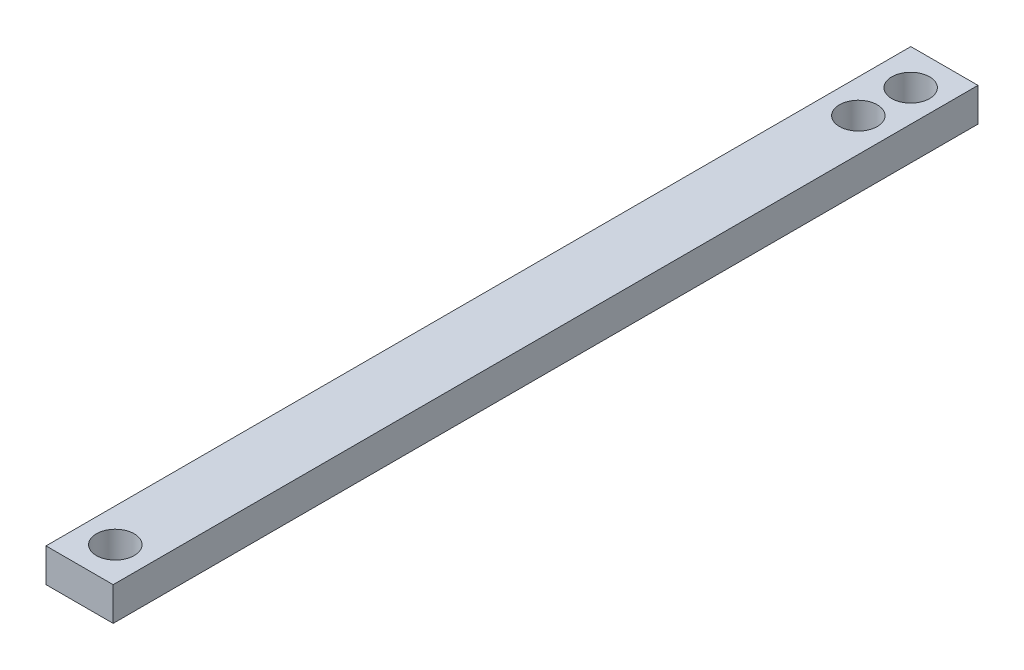
from build123d import *

# Parameters (mm, degrees)
SKETCH1_W           = 50.8
SKETCH1_H           = 25.4
BOSS_EXTRUDE1_DEPTH = 615.95
SKETCH2_R           = 14.3002
CUT_EXTRUDE1_DEPTH  = 762
SKETCH3_W           = 50.8
SKETCH3_H           = 25.4
BOSS_EXTRUDE2_DEPTH = 38.1
SKETCH4_R           = 14.3002
CUT_EXTRUDE2_DEPTH  = 101.6


with BuildPart() as part:
    # Sketch1 → Boss-Extrude1 (new body)
    with BuildSketch(Plane.XY):
        with Locations((25.4, 12.7)):
            Rectangle(SKETCH1_W, SKETCH1_H)
    extrude(amount=BOSS_EXTRUDE1_DEPTH)

    # Sketch2 → Cut-Extrude1 (cut)
    with BuildSketch(Plane(origin=(0, 25.4, 0), x_dir=(1, 0, 0), z_dir=(0, 1, 0))):
        with Locations((25.4, -588.9498)):
            Circle(SKETCH2_R)
        with Locations((25.4, -27.0002)):
            Circle(SKETCH2_R)
    extrude(amount=-CUT_EXTRUDE1_DEPTH, mode=Mode.SUBTRACT)

    # Sketch3 → Boss-Extrude2 (add)
    with BuildSketch(Plane(origin=(0, 0, 0), x_dir=(-1, 0, 0), z_dir=(0, 0, -1))):
        with Locations((-25.4, 12.7)):
            Rectangle(SKETCH3_W, SKETCH3_H)
    extrude(amount=BOSS_EXTRUDE2_DEPTH)

    # Sketch4 → Cut-Extrude2 (cut)
    with BuildSketch(Plane(origin=(0, 25.4, 0), x_dir=(1, 0, 0), z_dir=(0, 1, 0))):
        with Locations((26.882193512, 11.0998)):
            Circle(SKETCH4_R)
    extrude(amount=-CUT_EXTRUDE2_DEPTH, mode=Mode.SUBTRACT)


solid = part.part
